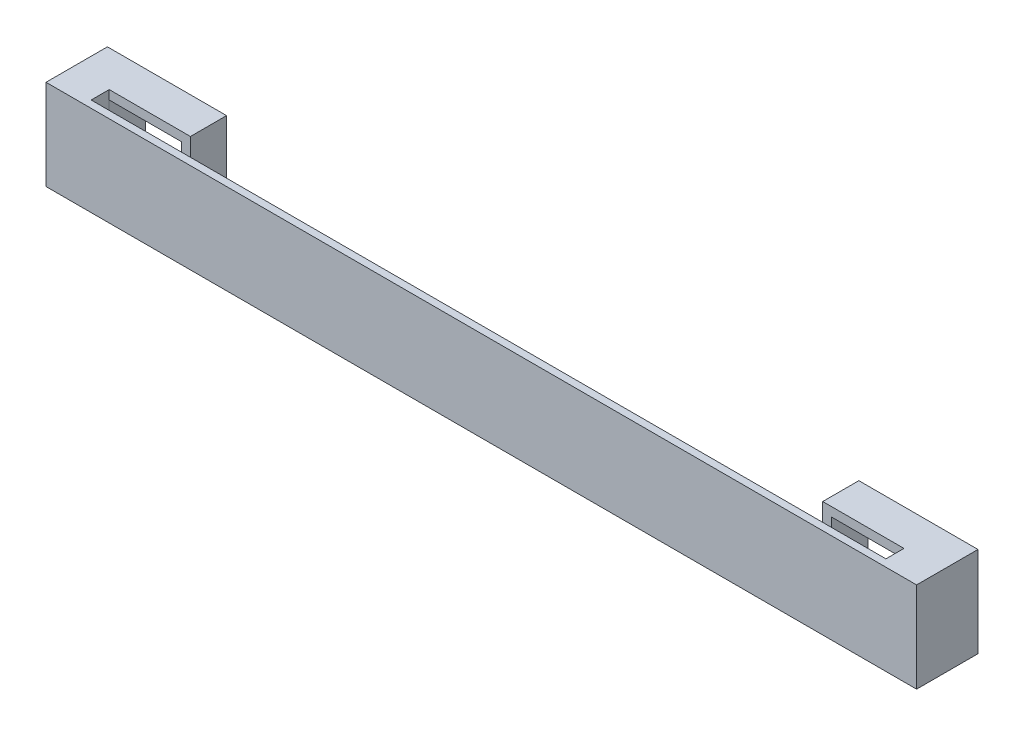
from build123d import *

# Parameters (mm, degrees)
ESQUISSE1_W                     = 20
ESQUISSE1_H                     = 20
BOSS_EXTRU_1_DEPTH              = 10
ESQUISSE2_W                     = 237.218260139
ESQUISSE2_H                     = 128.428413156
ENL_V_MAT_EXTRU_6_DEPTH         = 10
ENL_V_MAT_EXTRU_7_DEPTH         = 10
BOSS_EXTRU_4_START              = -2
BOSS_EXTRU_4_DEPTH              = 9
ESQUISSE10_W                    = 2
ESQUISSE10_H                    = 4
BOSS_EXTRU_5_DEPTH              = 224.980719072
ESQUISSE11_W                    = 2.5
ESQUISSE11_H                    = 5
BOSS_EXTRU_6_DEPTH              = 4
SYM_TRIE1_START                 = 8
SYM_TRIE1_OUTLINE_W             = 4
SYM_TRIE1_OUTLINE_H             = 4
SYM_TRIE1_DEPTH                 = 9
BOSS_EXTRU_9_REACH              = 128.238
BOSS_EXTRU_9_DIRECTION_2_REACH  = 128.238
BOSS_EXTRU_10_REACH             = 128.238
BOSS_EXTRU_10_DIRECTION_2_REACH = 128.238
ESQUISSE14_W                    = 8
ESQUISSE14_H                    = 8
BOSS_EXTRU_11_DEPTH             = 25


# Read off the part's stored shape, not the designer's step: Symétrie1
with BuildPart() as part:
    # Esquisse1 → Boss.-Extru.1 (new body)
    with BuildSketch(Plane.XY):
        Polygon((-116.245179768, 65.5), (-116.245179768, 40.5), (-116.189357624, -40.5), (-116.189357624, -65.5), (108.67971716, -65.5), (108.67971716, -40.5), (108.735539304, 40.5), (108.735539304, 65.5), align=None)
        Polygon((83.754820232, 40.5), (106.172004788, 40.5), (106.172004788, -40.5), (83.67971716, -40.5), (83.67971716, -63), (-91.189357624, -63), (-91.189357624, -40.5), (-113.681645253, -40.5), (-113.681645253, 40.5), (-91.264460696, 40.5), (-91.264460696, 63), (83.754820232, 63), align=None, mode=Mode.SUBTRACT)
        Polygon((-113.66622051, -63.007706414), (-113.681645253, -43.007712371), (-93.681645253, -43.023131157), (-93.697069995, -62.992287629), align=None, mode=Mode.SUBTRACT)
        Polygon((106.172004788, -43.007712371), (106.156580046, -63.007706414), (86.187429531, -62.992287629), (86.172004788, -43.023131157), align=None, mode=Mode.SUBTRACT)
        with Locations((-103.754820232, 53)):
            Rectangle(ESQUISSE1_W, ESQUISSE1_H, mode=Mode.SUBTRACT)
        with Locations((96.245179768, 53)):
            Rectangle(ESQUISSE1_W, ESQUISSE1_H, mode=Mode.SUBTRACT)
    extrude(amount=BOSS_EXTRU_1_DEPTH)

    # Esquisse2 → Enlèv. mat.-Extru.6 (cut)
    with BuildSketch(Plane(origin=(0, 0, 0), x_dir=(-1, 0, 0), z_dir=(0, 0, -1))):
        with Locations((9.873590765, -23.714206578)):
            Rectangle(ESQUISSE2_W, ESQUISSE2_H)
    extrude(amount=-ENL_V_MAT_EXTRU_6_DEPTH, mode=Mode.SUBTRACT)

    # Esquisse4 → Enlèv. mat.-Extru.7 (cut)
    with BuildSketch(Plane(origin=(0, 0, 0), x_dir=(-1, 0, 0), z_dir=(0, 0, -1))):
        Polygon((-83.754820232, 63), (-83.754820232, 68.626436571), (91.264460696, 65.5), (91.264460696, 63), align=None)
    extrude(amount=-ENL_V_MAT_EXTRU_7_DEPTH, mode=Mode.SUBTRACT)


with BuildPart() as enl_v_mat_extru_7_piece_1:
    # of the separate pieces the step leaves, piece 1, a body of its own (enl_v_mat_extru_7_pieces)
    add(part.part.solids().sort_by_distance((-116.245179768, 65.5, 0))[0])

    # Esquisse9 → Boss.-Extru.4 (add)
    with BuildSketch(Plane.XY.offset(10).offset(BOSS_EXTRU_4_START)):
        Polygon((-116.245179768, 53), (-116.245179768, 55), (-120.245179768, 55), (-120.245179768, 51), (-116.245179768, 51), align=None)
    extrude(amount=BOSS_EXTRU_4_DEPTH)

    # Esquisse10 → Boss.-Extru.5 (add)
    with BuildSketch(Plane(origin=(-116.245179768, 0, 0), x_dir=(0, 0, -1), z_dir=(1, 0, 0))):
        with Locations((-16, 53)):
            Rectangle(ESQUISSE10_W, ESQUISSE10_H)
    extrude(amount=BOSS_EXTRU_5_DEPTH)

    # Esquisse11 → Boss.-Extru.6 (add)
    with BuildSketch(Plane.XZ.offset(-51)):
        with Locations((-114.995179768, 12.5)):
            Rectangle(ESQUISSE11_W, ESQUISSE11_H)
    extrude(amount=-BOSS_EXTRU_6_DEPTH)

    # Symétrie1 outline → Symétrie1 (add)
    with BuildSketch(Plane.XY.offset(SYM_TRIE1_START)):
        with Locations((-122.245179768, 53)):
            Rectangle(SYM_TRIE1_OUTLINE_W, SYM_TRIE1_OUTLINE_H)
    extrude(amount=SYM_TRIE1_DEPTH)


with BuildPart() as enl_v_mat_extru_7_piece_2:
    # of the separate pieces the step leaves, piece 2, a body of its own (enl_v_mat_extru_7_pieces)
    add(part.part.solids().sort_by_distance((108.735539304, 65.5, 0))[0])

    # Boss.-Extru.9: up to this face of the body (flat: up to its plane)
    boss_extru_9_end = Plane(enl_v_mat_extru_7_piece_2.part.faces().sort_by_distance((96.245179768, 65.5, 5))[0])
    # Esquisse12 → Boss.-Extru.9 (add, up to the picked face)
    with BuildSketch(Plane(origin=(0, 55, 0), x_dir=(1, 0, 0), z_dir=(0, 1, 0)), mode=Mode.PRIVATE) as boss_extru_9_sk1:
        Polygon((108.735539304, -10), (108.735539304, -8), (116.735539304, -8), (116.735539304, -17), (108.735539304, -17), (108.735539304, -15), (106.245539304, -15), (106.245539304, -10), align=None)
    boss_extru_9_tool1 = split(extrude(boss_extru_9_sk1.sketch, amount=BOSS_EXTRU_9_REACH, mode=Mode.PRIVATE), bisect_by=boss_extru_9_end, keep=Keep.BOTH, mode=Mode.PRIVATE)

    add(enl_v_mat_extru_7_piece_1.part)  # Boss.-Extru.9 merges Enlèv. mat.-Extru.7 piece 1
    add(boss_extru_9_tool1.solids().sort_by(Axis((111.962298, 55, 12.5), (0, 1, 0)))[0])

    # Boss.-Extru.9 direction 2: up to this face of the body (flat: up to its plane)
    boss_extru_9_direction_2_end = Plane(enl_v_mat_extru_7_piece_2.part.faces().sort_by_distance((96.245179768, 40.5, 5))[0])
    # Esquisse12 → Boss.-Extru.9 direction 2 (add, up to the picked face)
    with BuildSketch(Plane(origin=(0, 55, 0), x_dir=(1, 0, 0), z_dir=(0, 1, 0)), mode=Mode.PRIVATE) as boss_extru_9_direction_2_sk1:
        Polygon((108.735539304, -10), (108.735539304, -8), (116.735539304, -8), (116.735539304, -17), (108.735539304, -17), (108.735539304, -15), (106.245539304, -15), (106.245539304, -10), align=None)
    boss_extru_9_direction_2_tool1 = split(extrude(boss_extru_9_direction_2_sk1.sketch, amount=-BOSS_EXTRU_9_DIRECTION_2_REACH, mode=Mode.PRIVATE), bisect_by=boss_extru_9_direction_2_end, keep=Keep.BOTH, mode=Mode.PRIVATE)
    add(boss_extru_9_direction_2_tool1.solids().sort_by(Axis((111.962298, 55, 12.5), (0, -1, 0)))[0])

    # Boss.-Extru.10: up to this face of the body (flat: up to its plane)
    boss_extru_10_end = Plane(enl_v_mat_extru_7_piece_2.part.faces().sort_by_distance((100.216105898, 65.5, 6.894873222))[0])
    # Esquisse13 → Boss.-Extru.10 (add, up to the picked face)
    with BuildSketch(Plane(origin=(0, 55, 0), x_dir=(1, 0, 0), z_dir=(0, 1, 0)), mode=Mode.PRIVATE) as boss_extru_10_sk1:
        Polygon((-124.245179768, -17), (108.735539304, -17), (108.735539304, -15), (-113.745179768, -15), (-113.745179768, -10), (-116.245179768, -10), (-116.245179768, -8), (-124.245179768, -8), align=None)
    boss_extru_10_tool1 = split(extrude(boss_extru_10_sk1.sketch, amount=BOSS_EXTRU_10_REACH, mode=Mode.PRIVATE), bisect_by=boss_extru_10_end, keep=Keep.BOTH, mode=Mode.PRIVATE)
    add(boss_extru_10_tool1.solids().sort_by(Axis((-22.049518, 55, 15.446639), (0, 1, 0)))[0])

    # Boss.-Extru.10 direction 2: up to this face of the body (flat: up to its plane)
    boss_extru_10_direction_2_end = Plane(enl_v_mat_extru_7_piece_2.part.faces().sort_by_distance((-103.754820232, 40.5, 5))[0])
    # Esquisse13 → Boss.-Extru.10 direction 2 (add, up to the picked face)
    with BuildSketch(Plane(origin=(0, 55, 0), x_dir=(1, 0, 0), z_dir=(0, 1, 0)), mode=Mode.PRIVATE) as boss_extru_10_direction_2_sk1:
        Polygon((-124.245179768, -17), (108.735539304, -17), (108.735539304, -15), (-113.745179768, -15), (-113.745179768, -10), (-116.245179768, -10), (-116.245179768, -8), (-124.245179768, -8), align=None)
    boss_extru_10_direction_2_tool1 = split(extrude(boss_extru_10_direction_2_sk1.sketch, amount=-BOSS_EXTRU_10_DIRECTION_2_REACH, mode=Mode.PRIVATE), bisect_by=boss_extru_10_direction_2_end, keep=Keep.BOTH, mode=Mode.PRIVATE)
    add(boss_extru_10_direction_2_tool1.solids().sort_by(Axis((-22.049518, 55, 15.446639), (0, -1, 0)))[0])

    # Esquisse14 → Boss.-Extru.11 (add)
    with BuildSketch(Plane(origin=(0, 65.5, 0), x_dir=(1, 0, 0), z_dir=(0, 1, 0))):
        with Locations((112.735539304, -4)):
            Rectangle(ESQUISSE14_W, ESQUISSE14_H)
        with Locations((-120.245179768, -4)):
            Rectangle(ESQUISSE14_W, ESQUISSE14_H)
    extrude(amount=-BOSS_EXTRU_11_DEPTH)


solid = enl_v_mat_extru_7_piece_2.part
